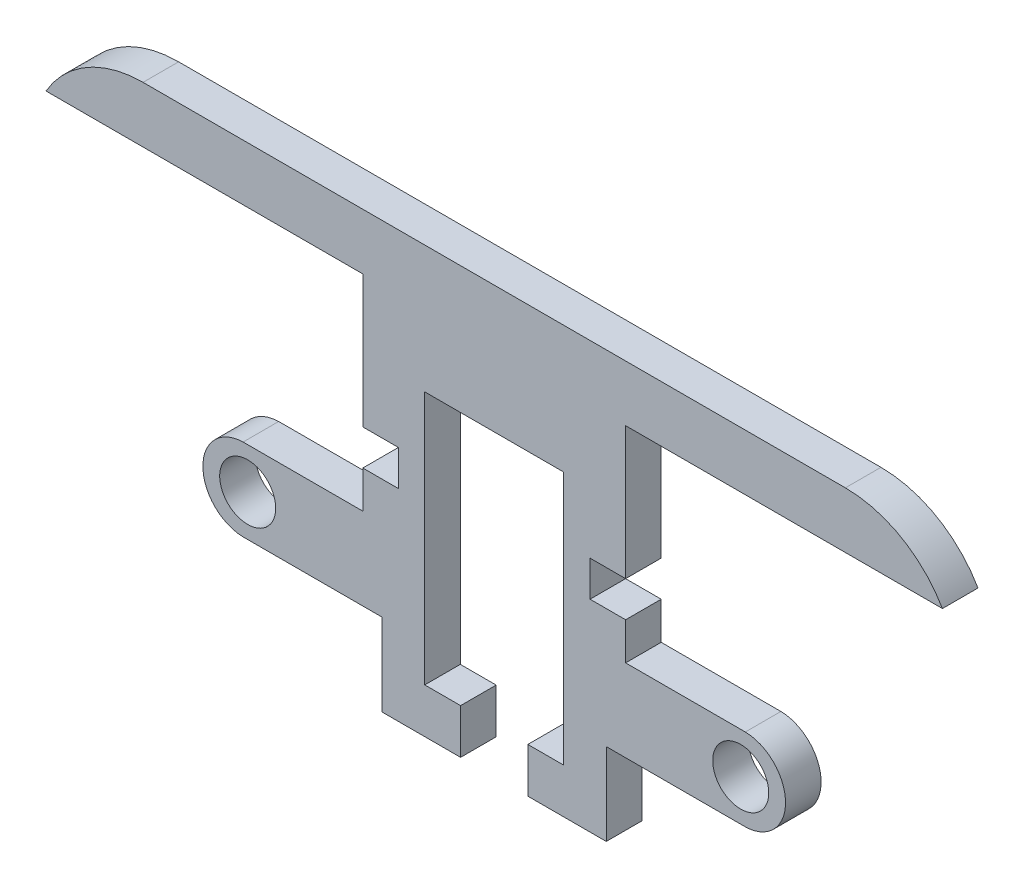
from build123d import *

# Parameters (mm, degrees)
SKETCH1_R           = 2.5
BOSS_EXTRUDE1_DEPTH = 3.175
FILLET1_R           = 10
SKETCH2_W           = 9
SKETCH2_H           = 21
CUT_EXTRUDE1_DEPTH  = 90.108082017
FILLET2_R           = 10
SKETCH4_W           = 90.343709808
SKETCH4_H           = 29.159436912
CUT_EXTRUDE3_DEPTH  = 83
CUT_EXTRUDE4_DEPTH  = 90.108082017


with BuildPart() as part:
    # Sketch1 → Boss-Extrude1 (new body)
    with BuildSketch(Plane.XY):
        with BuildLine():
            Line((-9.56, -38.262636689), (-9.56, -41.437636689))
            Line((-9.56, -41.437636689), (9.56, -41.437636689))
            Line((9.56, -41.437636689), (9.56, -38.262636689))
            Line((9.56, -38.262636689), (12.735, -38.262636689))
            Line((12.735, -38.262636689), (12.735, -41.437636689))
            Line((12.735, -41.437636689), (15.91, -41.437636689))
            Line((15.91, -41.437636689), (21.91, -41.437636689))
            Line((21.91, -41.437636689), (21.91, -32.437636689))
            Line((21.91, -32.437636689), (18.735, -32.437636689))
            Line((18.735, -32.437636689), (18.735, -20.437636689))
            Line((18.735, -20.437636689), (21.91, -20.437636689))
            Line((21.91, -20.437636689), (21.91, -9.437636689))
            Line((21.91, -9.437636689), (40, -9.437636689))
            Line((40, -9.437636689), (40, 30.562363311))
            Line((40, 30.562363311), (10, 30.562363311))
            Line((10, 30.562363311), (10, 45.562363311))
            Line((10, 45.562363311), (10, 48.89577614))
            Line((10, 48.89577614), (22.410269523, 48.89577614))
            ThreePointArc((22.410269523, 48.89577614), (26.000000001, 52.562363311), (22.410269523, 56.228950483))
            Line((22.410269523, 56.228950483), (11.727794547, 56.228950483))
            Line((11.727794547, 56.228950483), (11.727794547, 59.562363311))
            Line((11.727794547, 59.562363311), (10, 59.562363311))
            Line((10, 59.562363311), (8.552794547, 59.562363311))
            Line((8.552794547, 59.562363311), (8.552794547, 62.737363311))
            Line((8.552794547, 62.737363311), (11.727794547, 62.737363311))
            Line((11.727794547, 62.737363311), (11.727794547, 74.562363311))
            Line((11.727794547, 74.562363311), (40, 74.562363311))
            Line((40, 74.562363311), (40, 79.562363311))
            Line((40, 79.562363311), (0, 79.562363311))
            Line((0, 79.562363311), (-40, 79.562363311))
            Line((-40, 79.562363311), (-40, 74.562363311))
            Line((-40, 74.562363311), (-11.727794547, 74.562363311))
            Line((-11.727794547, 74.562363311), (-11.727794547, 62.737363311))
            Line((-11.727794547, 62.737363311), (-8.552794547, 62.737363311))
            Line((-8.552794547, 62.737363311), (-8.552794547, 59.562363311))
            Line((-8.552794547, 59.562363311), (-10, 59.562363311))
            Line((-10, 59.562363311), (-11.727794547, 59.562363311))
            Line((-11.727794547, 59.562363311), (-11.727794547, 56.228950483))
            Line((-11.727794547, 56.228950483), (-22.410269523, 56.228950483))
            ThreePointArc((-22.410269523, 56.228950483), (-26.000000001, 52.562363311), (-22.410269523, 48.89577614))
            Line((-22.410269523, 48.89577614), (-10, 48.89577614))
            Line((-10, 48.89577614), (-10, 45.562363311))
            Line((-10, 45.562363311), (-10, 30.562363311))
            Line((-10, 30.562363311), (-40, 30.562363311))
            Line((-40, 30.562363311), (-40, -9.437636689))
            Line((-40, -9.437636689), (-21.91, -9.437636689))
            Line((-21.91, -9.437636689), (-21.91, -20.437636689))
            Line((-21.91, -20.437636689), (-18.735, -20.437636689))
            Line((-18.735, -20.437636689), (-18.735, -32.437636689))
            Line((-18.735, -32.437636689), (-21.91, -32.437636689))
            Line((-21.91, -32.437636689), (-21.91, -41.437636689))
            Line((-21.91, -41.437636689), (-15.91, -41.437636689))
            Line((-15.91, -41.437636689), (-12.735, -41.437636689))
            Line((-12.735, -41.437636689), (-12.735, -38.262636689))
            Line((-12.735, -38.262636689), (-9.56, -38.262636689))
        make_face()
        with BuildLine():
            Line((4, 1.562363311), (-4, 1.562363311))
            ThreePointArc((-4, 1.562363311), (-4.707106781, 1.85525653), (-5, 2.562363311))
            Line((-5, 2.562363311), (-5, 3.562363311))
            ThreePointArc((-5, 3.562363311), (-4.707106781, 4.269470092), (-4, 4.562363311))
            Line((-4, 4.562363311), (4, 4.562363311))
            ThreePointArc((4, 4.562363311), (4.707106781, 4.269470092), (5, 3.562363311))
            Line((5, 3.562363311), (5, 2.562363311))
            ThreePointArc((5, 2.562363311), (4.707106781, 1.85525653), (4, 1.562363311))
        make_face(mode=Mode.SUBTRACT)
        with Locations((-22, 52.562363311)):
            Circle(SKETCH1_R, mode=Mode.SUBTRACT)
        with Locations((22, 52.562363311)):
            Circle(SKETCH1_R, mode=Mode.SUBTRACT)
    extrude(amount=BOSS_EXTRUDE1_DEPTH)

    # Fillet1
    # the kernel refuses this fillet: 10 mm, written as the material it takes off along each edge
    with BuildSketch(Plane(origin=(-40, 79.562363311, -21.650635095), x_dir=(0, -1, 0), z_dir=(0, 0, 1))) as fillet1_piece_1:
        with BuildLine():
            CenterArc((10, 8.660254038), FILLET1_R, 180, 60)
            Line((0, 8.660254038), (-0.2, 8.660254038))
            Line((-0.2, 8.660254038), (-0.2, 0))
            Line((-0.2, 0), (0, -0.2))
            ThreePointArc((0, -0.2), (2.5, -0.2), (4.9, -0.173205081))
            Line((4.9, -0.173205081), (5, 0))
        make_face()
    extrude(amount=46.476270189, mode=Mode.SUBTRACT)
    with BuildSketch(Plane(origin=(40, 79.562363311, -21.650635095), x_dir=(-1, 0, 0), z_dir=(0, 0, 1))) as fillet1_piece_2:
        with BuildLine():
            CenterArc((8.660254038, 10), FILLET1_R, 210, 60)
            Line((0, 5), (-0.173205081, 4.9))
            ThreePointArc((-0.173205081, 4.9), (-0.2, 2.5), (-0.2, 0))
            Line((-0.2, 0), (0, -0.2))
            Line((0, -0.2), (8.660254038, -0.2))
            Line((8.660254038, -0.2), (8.660254038, 0))
        make_face()
    extrude(amount=46.476270189, mode=Mode.SUBTRACT)

    # Sketch2 → Cut-Extrude1 (cut, through all)
    with BuildSketch(Plane.XY.offset(3.175)):
        with Locations((-12.61, -26.137636689)):
            Rectangle(SKETCH2_W, SKETCH2_H)
    extrude(amount=-CUT_EXTRUDE1_DEPTH, mode=Mode.SUBTRACT)

    # Fillet2
    fillet2_edges = [part.edges().sort_by_distance(p)[0] for p in [
        (40, 30.562363311, 1.5875),
        (40, -9.437636689, 1.5875),
        (-40, -9.437636689, 1.5875),
        (-40, 30.562363311, 1.5875),
    ]]
    fillet(fillet2_edges, radius=FILLET2_R)

    # Sketch4 → Cut-Extrude3 (cut)
    with BuildSketch(Plane.XZ.offset(41.437636689)):
        Rectangle(SKETCH4_W, SKETCH4_H)
    extrude(amount=-CUT_EXTRUDE3_DEPTH, mode=Mode.SUBTRACT)

    # Sketch5 → Cut-Extrude4 (cut, through all)
    with BuildSketch(Plane.XY.offset(3.175)):
        Polygon((6.2, 68.212363311), (-6.2, 68.212363311), (-6.2, 45.562363311), (-3, 45.562363311), (-3, 40.562363311), (-0.113822398, 40.562363311), (0.113822398, 40.562363311), (3, 40.562363311), (3, 45.562363311), (6.2, 45.562363311), align=None)
    extrude(amount=-CUT_EXTRUDE4_DEPTH, mode=Mode.SUBTRACT)


solid = part.part
